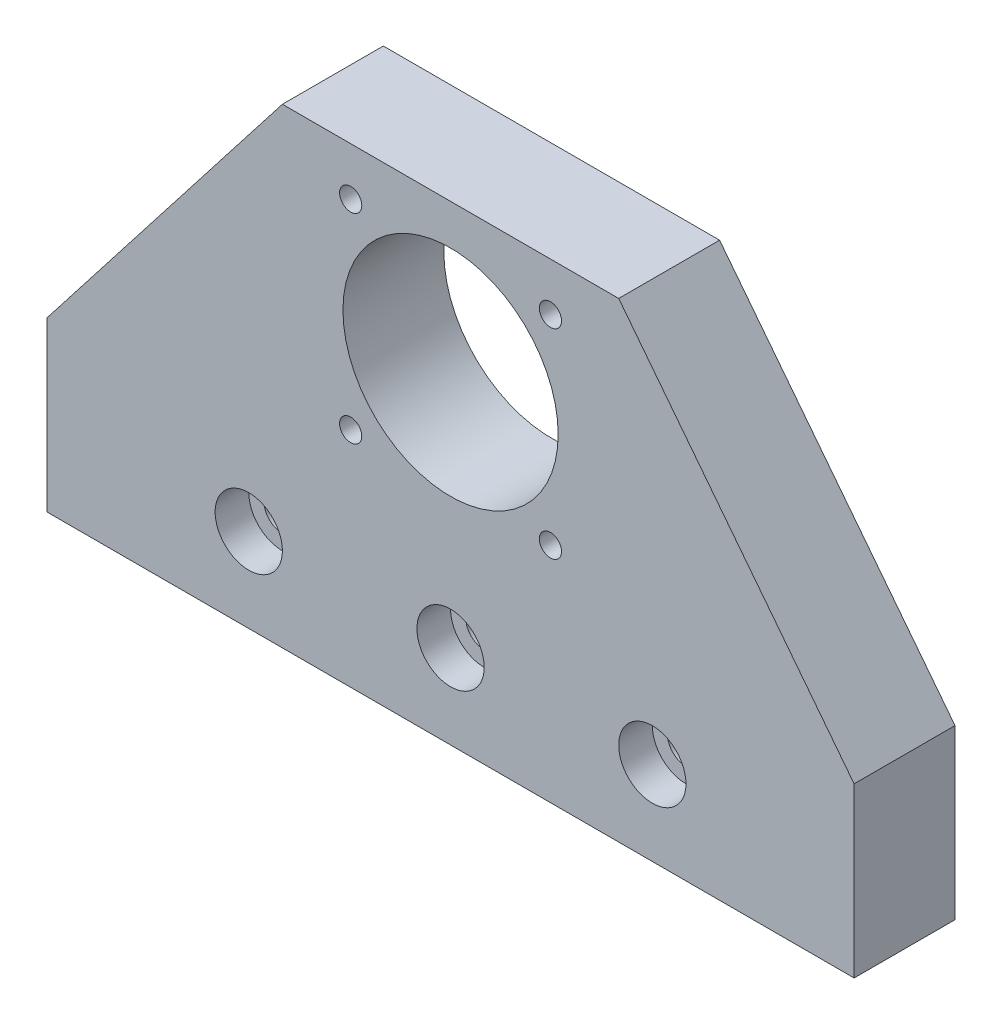
from build123d import *

# Parameters (mm, degrees)
BOSS_EXTRUDE1_DEPTH            = 15
CBORE_FOR_M5_SHCS1_D           = 5.5
CBORE_FOR_M5_SHCS1_CBORE_D     = 10
CBORE_FOR_M5_SHCS1_CBORE_DEPTH = 5
SKETCH4_R                      = 16
CUT_EXTRUDE1_DEPTH             = 94.407708461
M4_TAPPED_HOLE1_D              = 3.3
M4_TAPPED_HOLE1_DEPTH          = 16.1
M4_TAPPED_HOLE1_TIP            = 0.991420021


with BuildPart() as part:
    # Sketch1 → Boss-Extrude1 (new body)
    with BuildSketch(Plane.XY):
        Polygon((60, 0), (-60, 0), (-60, 25), (-25, 70), (25, 70), (60, 25), align=None)
    extrude(amount=BOSS_EXTRUDE1_DEPTH)

    # CBORE for M5 SHCS1 (through all)
    with Locations(Plane(origin=(-30, 12.5, 15), x_dir=(1, 0, 0), z_dir=(0, 0, 1))):
        with Locations((0, 0), (30, 0), (60, 0)):
            CounterBoreHole(CBORE_FOR_M5_SHCS1_D / 2, CBORE_FOR_M5_SHCS1_CBORE_D / 2, CBORE_FOR_M5_SHCS1_CBORE_DEPTH)

    # Sketch4 → Cut-Extrude1 (cut, through all)
    with BuildSketch(Plane.XY.offset(15)):
        with Locations((0, 48)):
            Circle(SKETCH4_R)
    extrude(amount=-CUT_EXTRUDE1_DEPTH, mode=Mode.SUBTRACT)

    # M4 Tapped Hole1
    with Locations(Plane(origin=(-14.849242405, 62.849242405, 15), x_dir=(1, 0, 0), z_dir=(0, 0, 1))):
        with Locations((0, 0), (29.69848481, 0), (29.69848481, -29.69848481), (0, -29.69848481)):
            Hole(M4_TAPPED_HOLE1_D / 2, depth=M4_TAPPED_HOLE1_DEPTH)
            with Locations((0, 0, -(M4_TAPPED_HOLE1_DEPTH + M4_TAPPED_HOLE1_TIP / 2))):  # 118° drill point
                Cone(0, M4_TAPPED_HOLE1_D / 2, M4_TAPPED_HOLE1_TIP, mode=Mode.SUBTRACT)


solid = part.part
